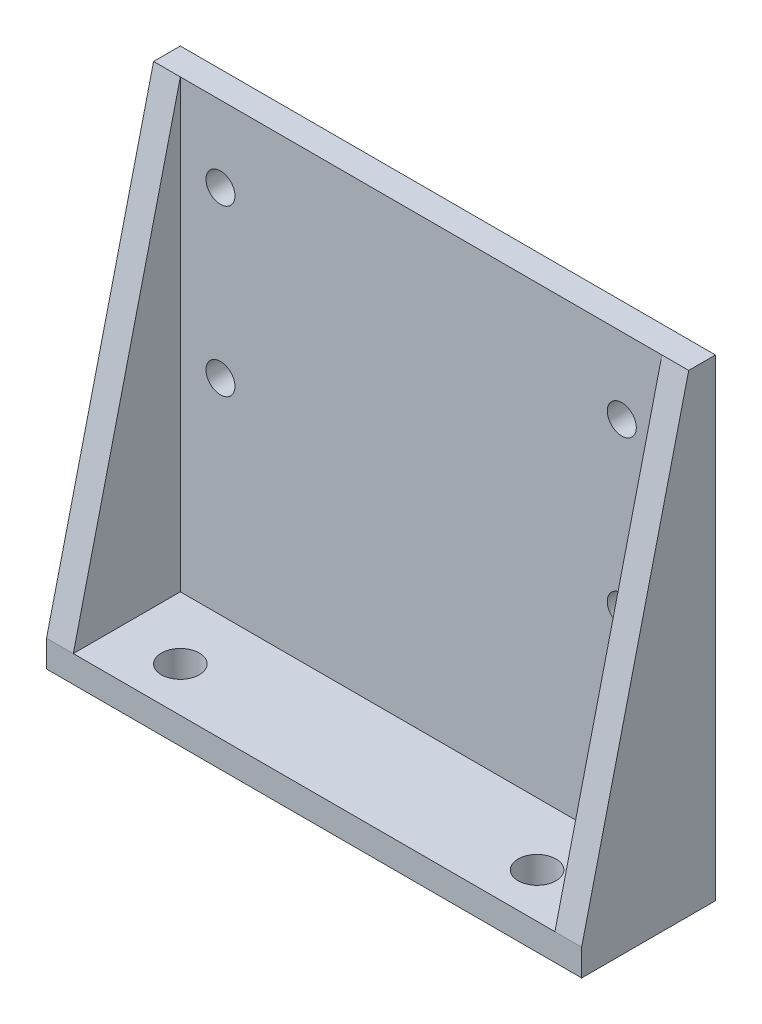
from build123d import *

# Parameters (mm, degrees)
SKETCH1_W           = 60
SKETCH1_H           = 15
SKETCH1_R           = 2.125
BOSS_EXTRUDE1_DEPTH = 3
SKETCH2_W           = 60
SKETCH2_H           = 50
SKETCH2_R           = 1.625
BOSS_EXTRUDE2_DEPTH = 3
BOSS_EXTRUDE3_DEPTH = 3


with BuildPart() as part:
    # Sketch1 → Boss-Extrude1 (new body)
    with BuildSketch(Plane(origin=(0, 0, 0), x_dir=(1, 0, 0), z_dir=(0, 1, 0))):
        with Locations((30, 7.5)):
            Rectangle(SKETCH1_W, SKETCH1_H)
        with Locations((10, 5)):
            Circle(SKETCH1_R, mode=Mode.SUBTRACT)
        with Locations((50, 5)):
            Circle(SKETCH1_R, mode=Mode.SUBTRACT)
    extrude(amount=BOSS_EXTRUDE1_DEPTH)

    # Sketch2 → Boss-Extrude2 (add)
    with BuildSketch(Plane(origin=(0, 0, -15), x_dir=(-1, 0, 0), z_dir=(0, 0, -1))):
        with Locations((-30, 28)):
            Rectangle(SKETCH2_W, SKETCH2_H)
        with Locations((-52.5, 44.5)):
            Circle(SKETCH2_R, mode=Mode.SUBTRACT)
        with Locations((-52.5, 26)):
            Circle(SKETCH2_R, mode=Mode.SUBTRACT)
        with Locations((-7.5, 26)):
            Circle(SKETCH2_R, mode=Mode.SUBTRACT)
        with Locations((-7.5, 44.5)):
            Circle(SKETCH2_R, mode=Mode.SUBTRACT)
    extrude(amount=-BOSS_EXTRUDE2_DEPTH)

    # Sketch3 → Boss-Extrude3 (add)
    with BuildSketch(Plane.ZY):
        Polygon((-12, 53), (0, 3), (-12, 3), align=None)
    boss_extrude3 = extrude(amount=-BOSS_EXTRUDE3_DEPTH)

    # Mirror1: Boss-Extrude3 across plane
    add(boss_extrude3.mirror(Plane.ZY.offset(-30)))


solid = part.part
